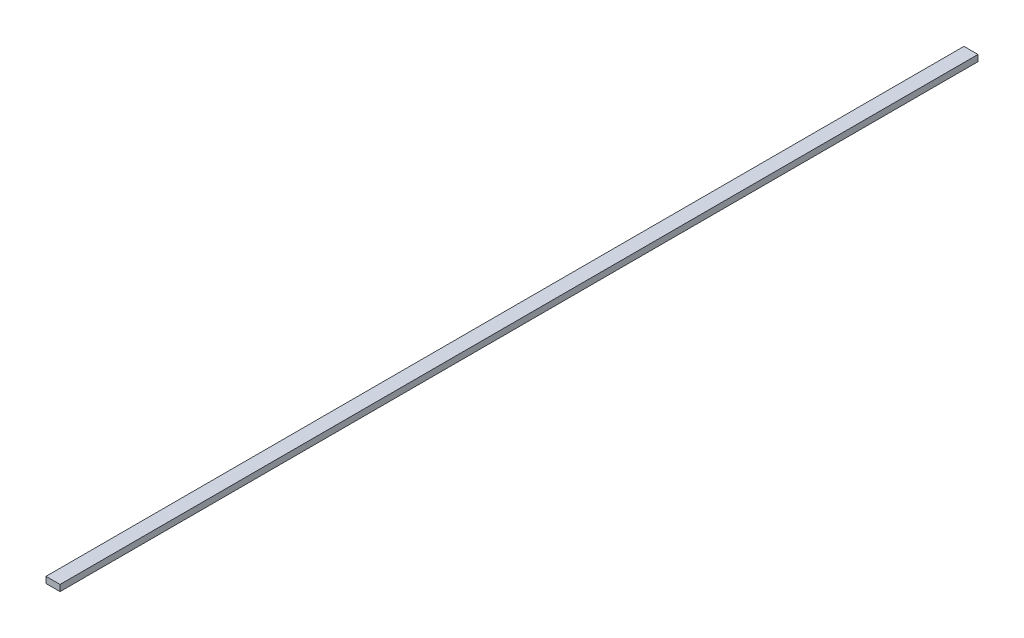
from build123d import *

# Parameters (mm, degrees)
SKETCH1_W           = 16.6624
SKETCH1_H           = 37.2872
BOSS_EXTRUDE1_DEPTH = 1219.2


with BuildPart() as part:
    # Sketch1 → Boss-Extrude1 (new, symmetric)
    with BuildSketch(Plane(origin=(0, 0, 0), x_dir=(0, 1, 0), z_dir=(0, 0, 1))):
        Rectangle(SKETCH1_W, SKETCH1_H)
    extrude(amount=BOSS_EXTRUDE1_DEPTH, both=True)


solid = part.part
